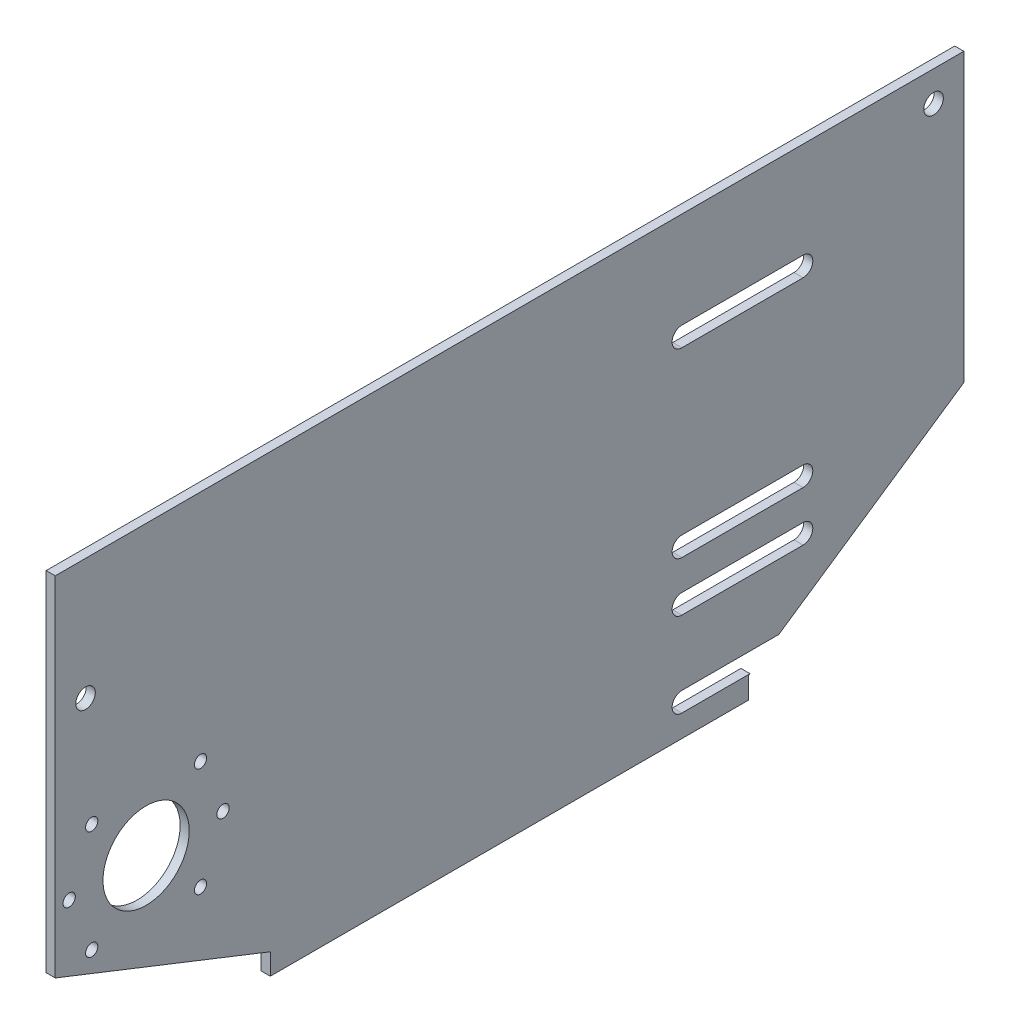
from build123d import *

# Parameters (mm, degrees)
SKETCH1_W           = 300
SKETCH1_H           = 150
SKETCH1_R           = 14.235
BOSS_EXTRUDE1_DEPTH = 3
CUT_EXTRUDE1_REACH  = 337.424
SKETCH2_R           = 3.225
SKETCH4_R           = 2.0193
CUT_EXTRUDE4_DEPTH  = 336.423612765
CUT_EXTRUDE5_DEPTH  = 336.423612765
SKETCH6_R           = 3.225
CUT_EXTRUDE6_DEPTH  = 10


with BuildPart() as part:
    # Sketch1 → Boss-Extrude1 (new body)
    with BuildSketch(Plane(origin=(0, 0, 0), x_dir=(0, 0, -1), z_dir=(1, 0, 0))):
        with Locations((150, 75)):
            Rectangle(SKETCH1_W, SKETCH1_H)
        with Locations((30, 55)):
            Circle(SKETCH1_R, mode=Mode.SUBTRACT)
    extrude(amount=BOSS_EXTRUDE1_DEPTH)

    # Sketch2 → Cut-Extrude1 (cut, up to next)
    with BuildSketch(Plane.ZY, mode=Mode.PRIVATE) as cut_extrude1_sk1:
        with Locations((-290, 140)):
            Circle(SKETCH2_R)
    cut_extrude1_tool1 = extrude(cut_extrude1_sk1.sketch, amount=-CUT_EXTRUDE1_REACH, mode=Mode.PRIVATE) & part.part
    # Sketch2 → Cut-Extrude1 (cut, up to next)
    with BuildSketch(Plane.ZY, mode=Mode.PRIVATE) as cut_extrude1_sk2:
        with Locations((-10, 110)):
            Circle(SKETCH2_R)
    cut_extrude1_tool2 = extrude(cut_extrude1_sk2.sketch, amount=-CUT_EXTRUDE1_REACH, mode=Mode.PRIVATE) & part.part
    # Sketch2 → Cut-Extrude1 (cut, up to next)
    with BuildSketch(Plane.ZY, mode=Mode.PRIVATE) as cut_extrude1_sk3:
        with Locations((-290, 30)):
            Circle(SKETCH2_R)
    cut_extrude1_tool3 = extrude(cut_extrude1_sk3.sketch, amount=-CUT_EXTRUDE1_REACH, mode=Mode.PRIVATE) & part.part
    # Sketch2 → Cut-Extrude1 (cut, up to next)
    with BuildSketch(Plane.ZY, mode=Mode.PRIVATE) as cut_extrude1_sk4:
        with BuildLine():
            Line((-246.901029004, 58.225), (-206.901029004, 58.225))
            ThreePointArc((-206.901029004, 58.225), (-203.676029004, 55), (-206.901029004, 51.775))
            Line((-206.901029004, 51.775), (-246.901029004, 51.775))
            ThreePointArc((-246.901029004, 51.775), (-250.126029004, 55), (-246.901029004, 58.225))
        make_face()
    cut_extrude1_tool4 = extrude(cut_extrude1_sk4.sketch, amount=-CUT_EXTRUDE1_REACH, mode=Mode.PRIVATE) & part.part
    # Sketch2 → Cut-Extrude1 (cut, up to next)
    with BuildSketch(Plane.ZY, mode=Mode.PRIVATE) as cut_extrude1_sk5:
        with BuildLine():
            Line((-206.901029004, 111.77), (-246.901029004, 111.77))
            ThreePointArc((-246.901029004, 111.77), (-250.131029004, 115), (-246.901029004, 118.23))
            Line((-246.901029004, 118.23), (-206.901029004, 118.23))
            ThreePointArc((-206.901029004, 118.23), (-203.671029004, 115), (-206.901029004, 111.77))
        make_face()
    cut_extrude1_tool5 = extrude(cut_extrude1_sk5.sketch, amount=-CUT_EXTRUDE1_REACH, mode=Mode.PRIVATE) & part.part
    # Sketch2 → Cut-Extrude1 (cut, up to next)
    with BuildSketch(Plane.ZY, mode=Mode.PRIVATE) as cut_extrude1_sk6:
        with BuildLine():
            Line((-246.901029004, 41.775), (-206.901029004, 41.775))
            ThreePointArc((-206.901029004, 41.775), (-203.676029004, 38.55), (-206.901029004, 35.325))
            Line((-206.901029004, 35.325), (-246.901029004, 35.325))
            ThreePointArc((-246.901029004, 35.325), (-250.126029004, 38.55), (-246.901029004, 41.775))
        make_face()
    cut_extrude1_tool6 = extrude(cut_extrude1_sk6.sketch, amount=-CUT_EXTRUDE1_REACH, mode=Mode.PRIVATE) & part.part
    # Sketch2 → Cut-Extrude1 (cut, up to next)
    with BuildSketch(Plane.ZY, mode=Mode.PRIVATE) as cut_extrude1_sk7:
        with BuildLine():
            Line((-246.901029004, 13.775), (-206.901029004, 13.775))
            ThreePointArc((-206.901029004, 13.775), (-203.676029004, 10.55), (-206.901029004, 7.325))
            Line((-206.901029004, 7.325), (-246.901029004, 7.325))
            ThreePointArc((-246.901029004, 7.325), (-250.126029004, 10.55), (-246.901029004, 13.775))
        make_face()
    cut_extrude1_tool7 = extrude(cut_extrude1_sk7.sketch, amount=-CUT_EXTRUDE1_REACH, mode=Mode.PRIVATE) & part.part
    add(cut_extrude1_tool1.solids().sort_by_distance((0, 140, -290))[0], mode=Mode.SUBTRACT)
    add(cut_extrude1_tool2.solids().sort_by_distance((0, 110, -10))[0], mode=Mode.SUBTRACT)
    add(cut_extrude1_tool3.solids().sort_by_distance((0, 30, -290))[0], mode=Mode.SUBTRACT)
    add(cut_extrude1_tool4.solids().sort_by_distance((0, 55, -226.901029))[0], mode=Mode.SUBTRACT)
    add(cut_extrude1_tool5.solids().sort_by_distance((0, 115, -226.901029))[0], mode=Mode.SUBTRACT)
    add(cut_extrude1_tool6.solids().sort_by_distance((0, 38.55, -226.901029))[0], mode=Mode.SUBTRACT)
    add(cut_extrude1_tool7.solids().sort_by_distance((0, 10.55, -226.901029))[0], mode=Mode.SUBTRACT)

    # Sketch4 → Cut-Extrude4 (cut, through all)
    with BuildSketch(Plane(origin=(3, 0, 0), x_dir=(0, 0, -1), z_dir=(1, 0, 0))):
        with Locations((47.960512242, 37.039487758)):
            Circle(SKETCH4_R)
        with Locations((47.960512242, 72.960512242)):
            Circle(SKETCH4_R)
        with Locations((55.4, 55)):
            Circle(SKETCH4_R)
        with Locations((12.039487758, 72.960512242)):
            Circle(SKETCH4_R)
        with Locations((4.6, 55)):
            Circle(SKETCH4_R)
        with Locations((12.039487758, 37.039487758)):
            Circle(SKETCH4_R)
    extrude(amount=-CUT_EXTRUDE4_DEPTH, mode=Mode.SUBTRACT)

    # Sketch5 → Cut-Extrude5 (cut, through all)
    with BuildSketch(Plane.ZY):
        Polygon((-71, 7), (0, 35), (0, 0), (-71, 0), align=None)
    extrude(amount=-CUT_EXTRUDE5_DEPTH, mode=Mode.SUBTRACT)

    # Sketch6 → Cut-Extrude6 (cut)
    with BuildSketch(Plane.ZY):
        with BuildLine():
            Line((-228.92403237, 0), (-228.92403237, 7))
            Line((-228.92403237, 7), (-229.402713185, 7.325))
            Line((-229.402713185, 7.325), (-246.901029004, 7.325))
            ThreePointArc((-246.901029004, 7.325), (-250.126029004, 10.55), (-246.901029004, 13.775))
            Line((-246.901029004, 13.775), (-238.902686288, 13.775))
            Line((-238.902686288, 13.775), (-300, 55.256977808))
            Line((-300, 55.256977808), (-300, 0))
            Line((-300, 0), (-228.92403237, 0))
        make_face()
        with Locations((-290, 30)):
            Circle(SKETCH6_R, mode=Mode.SUBTRACT)
    extrude(amount=-CUT_EXTRUDE6_DEPTH, mode=Mode.SUBTRACT)


solid = part.part
